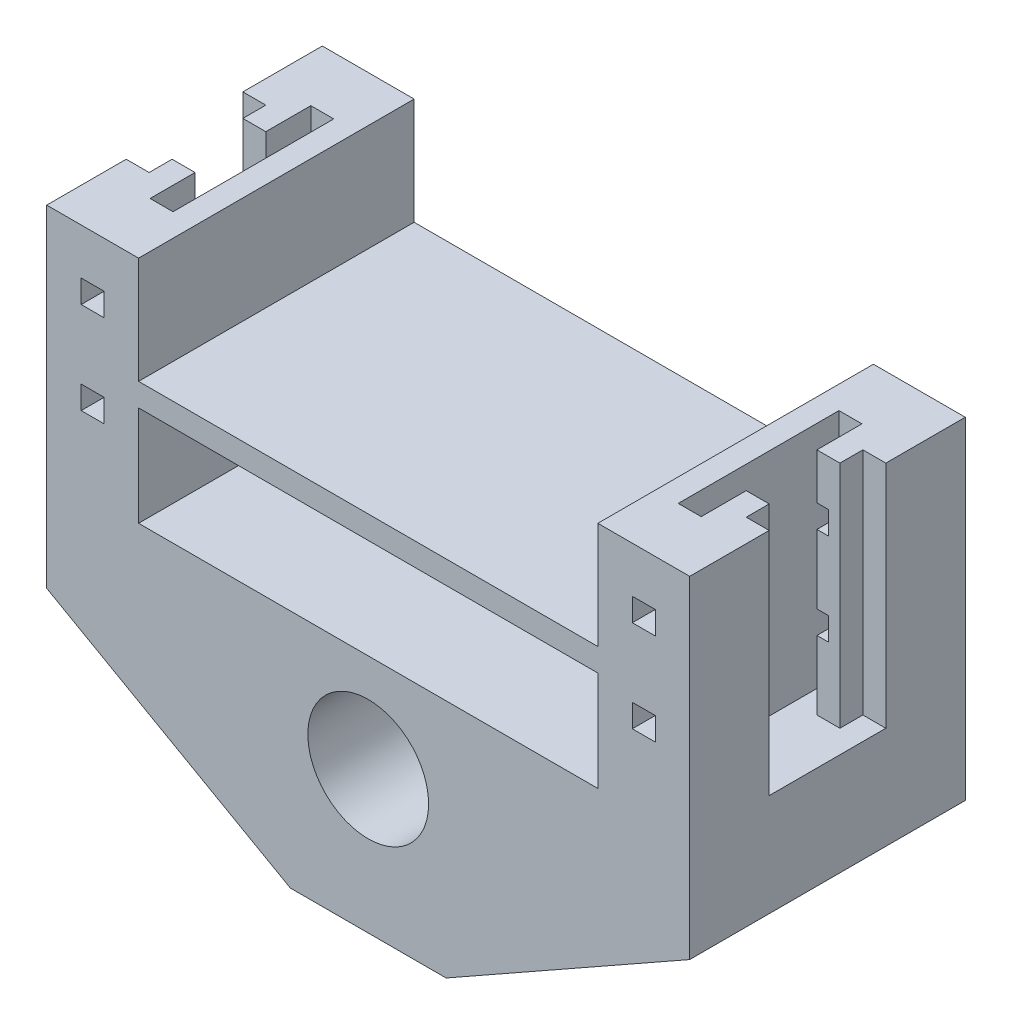
from build123d import *

# Parameters (mm, degrees)
BOSS_EXTRUDE2_DEPTH            = 30
BOSS_EXTRUDE2_DEPTH_BACK       = 30
EXTRUDE_THIN2_START            = -25
EXTRUDE_THIN2_DEPTH            = 50
SKETCH2_W                      = 60
SKETCH2_H                      = 5
BOSS_EXTRUDE3_DEPTH            = 100
BOSS_EXTRUDE4_DEPTH            = 30
BOSS_EXTRUDE4_DEPTH_BACK       = 30
CUT_EXTRUDE2_REACH             = 143.361
SKETCH4_W                      = 60
SKETCH4_H                      = 5
CUT_EXTRUDE2_DIRECTION_2_REACH = 143.361
BOSS_EXTRUDE5_DEPTH            = 30
BOSS_EXTRUDE5_DEPTH_BACK       = 30
DRONE_ARM_FIT_CUT_DEPTH        = 50
CUT_EXTRUDE3_START             = -60
SKETCH8_W                      = 5
SKETCH8_H                      = 5
CUT_EXTRUDE3_DEPTH             = 60
SKETCH10_R                     = 13.15
CUT_EXTRUDE5_DEPTH             = 60


# Read off the part's stored shape, not the designer's step: Extrude-Thin2
with BuildPart() as part:
    # Sketch1 → Boss-Extrude2 (new, two sides: drawn at the far end of the back side and taken through both)
    with BuildSketch(Plane.XY.offset(-BOSS_EXTRUDE2_DEPTH_BACK)):
        Polygon((-13.01396445, -23.830717844), (13.01396445, -23.830717844), (55, -0.089432632), (55, 13.432214294), (-55, 13.432214294), (-55, -0.089432632), align=None)
    extrude(amount=BOSS_EXTRUDE2_DEPTH + BOSS_EXTRUDE2_DEPTH_BACK)

    # Extrude-Thin2 outline → Extrude-Thin2 (add)
    with BuildSketch(Plane.XY.offset(EXTRUDE_THIN2_START)):
        Polygon((50, 13.432214294), (55, 13.432214294), (55, 68.432214294), (-55, 68.432214294), (-55, 13.432214294), (-50, 13.432214294), (-50, 63.432214294), (50, 63.432214294), align=None)
    extrude(amount=EXTRUDE_THIN2_DEPTH)

    # Sketch2 → Boss-Extrude3 (add)
    with BuildSketch(Plane.ZY.offset(-50)):
        with Locations((0, 37.694873029)):
            Rectangle(SKETCH2_W, SKETCH2_H)
    extrude(amount=BOSS_EXTRUDE3_DEPTH)

    # Sketch1<6> → Boss-Extrude4 (add, two sides: drawn at the far end of the back side and taken through both)
    with BuildSketch(Plane.XY.offset(-BOSS_EXTRUDE4_DEPTH_BACK)):
        Polygon((-55, -0.089432632), (-55, 13.432214294), (-70, 13.432214294), (-70, -8.839581066), (-16.961214453, -38.830717844), (16.961214453, -38.830717844), (70, -8.839581066), (70, 13.432214294), (55, 13.432214294), (55, -0.089432632), (13.01396445, -23.830717844), (-13.01396445, -23.830717844), align=None)
    extrude(amount=BOSS_EXTRUDE4_DEPTH + BOSS_EXTRUDE4_DEPTH_BACK)

    # Cut-Extrude2: up to this face of the body (flat: up to its plane)
    cut_extrude2_end = Plane(part.part.faces().sort_by_distance((-55, 40.932214294, 0))[0])
    # Sketch4 → Cut-Extrude2 (cut, up to the picked face)
    with BuildSketch(Plane(origin=(-50, 0, 0), x_dir=(0, 0, -1), z_dir=(1, 0, 0)), mode=Mode.PRIVATE) as cut_extrude2_sk1:
        with Locations((0, 65.932214294)):
            Rectangle(SKETCH4_W, SKETCH4_H)
    cut_extrude2_tool1 = split(extrude(cut_extrude2_sk1.sketch, amount=-CUT_EXTRUDE2_REACH, mode=Mode.PRIVATE), bisect_by=cut_extrude2_end, keep=Keep.BOTH, mode=Mode.PRIVATE)
    add(cut_extrude2_tool1.solids().sort_by(Axis((-50, 65.932214, 0), (-1, 0, 0)))[0], mode=Mode.SUBTRACT)

    # Cut-Extrude2 direction 2: up to this face of the body (flat: up to its plane)
    cut_extrude2_direction_2_end = Plane(part.part.faces().sort_by_distance((55, 40.932214294, 0))[0])
    # Sketch4 → Cut-Extrude2 direction 2 (cut, up to the picked face)
    with BuildSketch(Plane(origin=(-50, 0, 0), x_dir=(0, 0, -1), z_dir=(1, 0, 0)), mode=Mode.PRIVATE) as cut_extrude2_direction_2_sk1:
        with Locations((0, 65.932214294)):
            Rectangle(SKETCH4_W, SKETCH4_H)
    cut_extrude2_direction_2_tool1 = split(extrude(cut_extrude2_direction_2_sk1.sketch, amount=CUT_EXTRUDE2_DIRECTION_2_REACH, mode=Mode.PRIVATE), bisect_by=cut_extrude2_direction_2_end, keep=Keep.BOTH, mode=Mode.PRIVATE)
    add(cut_extrude2_direction_2_tool1.solids().sort_by(Axis((-50, 65.932214, 0), (1, 0, 0)))[0], mode=Mode.SUBTRACT)

    # Sketch1<7> → Boss-Extrude5 (add, two sides: drawn at the far end of the back side and taken through both)
    with BuildSketch(Plane.XY.offset(-BOSS_EXTRUDE5_DEPTH_BACK)):
        Polygon((-70, 13.432214294), (-55, 13.432214294), (-50, 13.432214294), (-50, 38.432214294), (-50, 63.432214294), (-70, 63.432214294), (-70, 38.432214294), align=None)
        Polygon((50, 38.432214294), (50, 13.432214294), (55, 13.432214294), (70, 13.432214294), (70, 38.432214294), (70, 63.432214294), (50, 63.432214294), align=None)
    extrude(amount=BOSS_EXTRUDE5_DEPTH + BOSS_EXTRUDE5_DEPTH_BACK)

    # Sketch7 → Drone Arm fit cut (cut)
    with BuildSketch(Plane(origin=(0, 63.432214294, 0), x_dir=(1, 0, 0), z_dir=(0, 1, 0))):
        Polygon((-70, -12.7), (-70, 12.7), (-65, 12.7), (-65, 7.7), (-60, 7.7), (-60, 12.7), (-60, 17.5), (-55, 17.5), (-55, -17.5), (-60, -17.5), (-60, -12.7), (-60, -7.7), (-65, -7.7), (-65, -12.7), align=None)
    drone_arm_fit_cut = extrude(amount=-DRONE_ARM_FIT_CUT_DEPTH, mode=Mode.SUBTRACT)

    # Mirror Drone arm fit cut: Drone Arm fit cut across plane
    add(drone_arm_fit_cut.mirror(Plane(origin=(0, 0, 0), x_dir=(0, 0, 1), z_dir=(1, 0, 0))), mode=Mode.SUBTRACT)

    # Sketch8 → Cut-Extrude3 (cut)
    with BuildSketch(Plane.XY.offset(30).offset(CUT_EXTRUDE3_START)):
        with Locations((-60, 50.932214294)):
            Rectangle(SKETCH8_W, SKETCH8_H)
        with Locations((-60, 30.932214294)):
            Rectangle(SKETCH8_W, SKETCH8_H)
    cut_extrude3 = extrude(amount=CUT_EXTRUDE3_DEPTH, mode=Mode.SUBTRACT)

    # Mirror1: Cut-Extrude3 across plane
    add(cut_extrude3.mirror(Plane(origin=(0, 0, 0), x_dir=(0, 0, 1), z_dir=(1, 0, 0))), mode=Mode.SUBTRACT)

    # Sketch10 → Cut-Extrude5 (cut)
    with BuildSketch(Plane.XY.offset(30)):
        with Locations((0, -7.922241987)):
            Circle(SKETCH10_R)
    extrude(amount=-CUT_EXTRUDE5_DEPTH, mode=Mode.SUBTRACT)


solid = part.part
